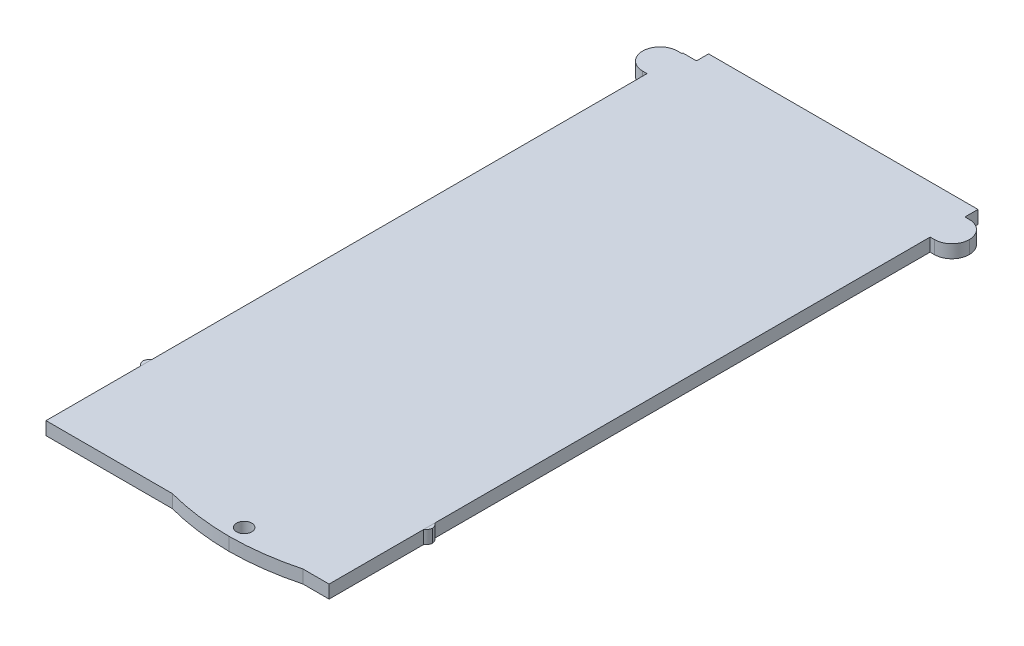
from build123d import *

# Parameters (mm, degrees)
CROQUIS1_W               = 65
CROQUIS1_H               = 146
SALIENTE_EXTRUIR1_DEPTH  = 3
CROQUIS2_W               = 8
CROQUIS2_H               = 3
SALIENTE_EXTRUIR2_DEPTH  = 5
REDONDEO1_R              = 4
REDONDEO1_OF_SIMETR_A1_R = 4
CROQUIS3_W               = 2.60095456
CROQUIS3_H               = 3.001101416
SALIENTE_EXTRUIR3_DEPTH  = 0.8
REDONDEO2_R              = 2
REDONDEO2_OF_SIMETR_A5_R = 2
CROQUIS4_W               = 65
CROQUIS4_H               = 3
CROQUIS4_W_2             = 30
CROQUIS4_H_2             = 2
SALIENTE_EXTRUIR4_DEPTH  = 3
REDONDEO3_R              = 60
CROQUIS6_W               = 3.139643751
CROQUIS6_H               = 2.781946526
CORTAR_EXTRUIR1_DEPTH    = 10
CROQUIS8_R               = 1.75
CORTAR_EXTRUIR2_DEPTH    = 10


# Some blends are built 0.0001 mm under size
with BuildPart() as part:
    # Croquis1 → Saliente-Extruir1 (new body)
    with BuildSketch(Plane(origin=(0, 0, 0), x_dir=(1, 0, 0), z_dir=(0, 1, 0))):
        Rectangle(CROQUIS1_W, CROQUIS1_H)
    extrude(amount=SALIENTE_EXTRUIR1_DEPTH)

    # Croquis2 → Saliente-Extruir2 (add)
    with BuildSketch(Plane(origin=(32.5, 0, 0), x_dir=(0, 0, -1), z_dir=(1, 0, 0))):
        with Locations((66, 1.5)):
            Rectangle(CROQUIS2_W, CROQUIS2_H)
    saliente_extruir2 = extrude(amount=SALIENTE_EXTRUIR2_DEPTH)

    # Redondeo1
    redondeo1_edges = [part.edges().sort_by_distance(p)[0] for p in [
        (37.5, 1.5, -62),
        (37.5, 1.5, -70),
    ]]
    fillet(redondeo1_edges, radius=REDONDEO1_R - 0.0001)  # a hair under: the kernel refuses the full size

    # Simetría1: Saliente-Extruir2 across plane
    add(saliente_extruir2.mirror(Plane(origin=(0, 0, 0), x_dir=(0, 0, 1), z_dir=(1, 0, 0))))

    # Redondeo1 of Simetría1
    redondeo1_of_simetr_a1_edges = [part.edges().sort_by_distance(p)[0] for p in [
        (-37.5, 1.5, -62),
        (-37.5, 1.5, -70),
    ]]
    fillet(redondeo1_of_simetr_a1_edges, radius=REDONDEO1_OF_SIMETR_A1_R - 0.0001)  # a hair under: the kernel refuses the full size

    # Croquis3 → Saliente-Extruir3 (add)
    with BuildSketch(Plane(origin=(32.5, 0, 0), x_dir=(0, 0, -1), z_dir=(1, 0, 0))):
        with Locations((-53.003039433, 1.500550708)):
            Rectangle(CROQUIS3_W, CROQUIS3_H)
    saliente_extruir3 = extrude(amount=SALIENTE_EXTRUIR3_DEPTH)

    # Redondeo2
    # the kernel refuses this fillet: 2 mm, written as the material it takes off along each edge
    with BuildSketch(Plane(origin=(33.3, 7.001101416, 51.702562153), x_dir=(-1, 0, 0), z_dir=(0, -1, 0)), Plane(origin=(33.3, -4, 54.303516713), x_dir=(-1, 0, 0), z_dir=(0, 1, 0))) as redondeo2_piece_1:
        with BuildLine():
            CenterArc((2, -1.6), REDONDEO2_R, 126.869897646, 53.130102354)
            Line((0, -1.6), (-0.04, -1.6))
            Line((-0.04, -1.6), (-0.04, 0))
            Line((-0.04, 0), (0, 0.04))
            ThreePointArc((0, 0.04), (0.4, 0.04), (0.776, 0.032))
            Line((0.776, 0.032), (0.8, 0))
        make_face()
    extrude(amount=11.001101416, mode=Mode.SUBTRACT)

    # Simetría5: Saliente-Extruir3 across plane
    add(saliente_extruir3.mirror(Plane(origin=(0, 0, 0), x_dir=(0, 0, 1), z_dir=(1, 0, 0))))

    # Redondeo2 of Simetría5
    # the kernel refuses this fillet: 2 mm, written as the material it takes off along each edge
    with BuildSketch(Plane(origin=(-33.3, 7.001101416, 51.702562153), x_dir=(1, 0, 0), z_dir=(0, -1, 0)), Plane(origin=(-33.3, -4, 54.303516713), x_dir=(1, 0, 0), z_dir=(0, 1, 0))) as redondeo2_of_simetr_a5_piece_1:
        with BuildLine():
            CenterArc((2, 1.6), REDONDEO2_OF_SIMETR_A5_R, 180, 53.130102354)
            Line((0, 1.6), (-0.04, 1.6))
            Line((-0.04, 1.6), (-0.04, 0))
            Line((-0.04, 0), (0, -0.04))
            ThreePointArc((0, -0.04), (0.4, -0.04), (0.776, -0.032))
            Line((0.776, -0.032), (0.8, 0))
        make_face()
    extrude(amount=11.001101416, mode=Mode.SUBTRACT)

    # Croquis4 → Saliente-Extruir4 (add)
    with BuildSketch(Plane(origin=(0, 3, 0), x_dir=(1, 0, 0), z_dir=(0, 1, 0))):
        with Locations((0, -74.5)):
            Rectangle(CROQUIS4_W, CROQUIS4_H)
        with Locations((11.5, -77)):
            Rectangle(CROQUIS4_W_2, CROQUIS4_H_2)
    extrude(amount=-SALIENTE_EXTRUIR4_DEPTH)

    # Redondeo3
    # the kernel refuses this fillet: 60 mm, written as the material it takes off along each edge
    with BuildSketch(Plane(origin=(26.5, 41.405728739, 78), x_dir=(0, 0, -1), z_dir=(0, -1, 0))) as redondeo3_piece_1:
        with BuildLine():
            CenterArc((60, -15.362291496), REDONDEO3_R, 165.164888418, 14.835111582)
            Line((0, -15.362291496), (0, 0))
            Line((0, 0), (2, 0))
        make_face()
    extrude(amount=79.811457479, mode=Mode.SUBTRACT)
    with BuildSketch(Plane(origin=(-3.5, 41.405728739, 78), x_dir=(1, 0, 0), z_dir=(0, -1, 0))) as redondeo3_piece_2:
        with BuildLine():
            CenterArc((15.362291496, -60), REDONDEO3_R, 90, 14.835111582)
            Line((0, -2), (0, 0))
            Line((0, 0), (15.362291496, 0))
        make_face()
    extrude(amount=79.811457479, mode=Mode.SUBTRACT)

    # Croquis6 → Cortar-Extruir1 (cut)
    with BuildSketch(Plane(origin=(0, 3, 0), x_dir=(1, 0, 0), z_dir=(0, 1, 0))):
        with Locations((-30.930178125, 71.609026737)):
            Rectangle(CROQUIS6_W, CROQUIS6_H)
    extrude(amount=-CORTAR_EXTRUIR1_DEPTH, mode=Mode.SUBTRACT)

    # Croquis8 → Cortar-Extruir2 (cut)
    with BuildSketch(Plane(origin=(0, 3, 0), x_dir=(1, 0, 0), z_dir=(0, 1, 0))):
        with Locations(Location((11.5, -74.5, 0), (0, 0, 270))):
            Circle(CROQUIS8_R)
    extrude(amount=-CORTAR_EXTRUIR2_DEPTH, mode=Mode.SUBTRACT)


solid = part.part
